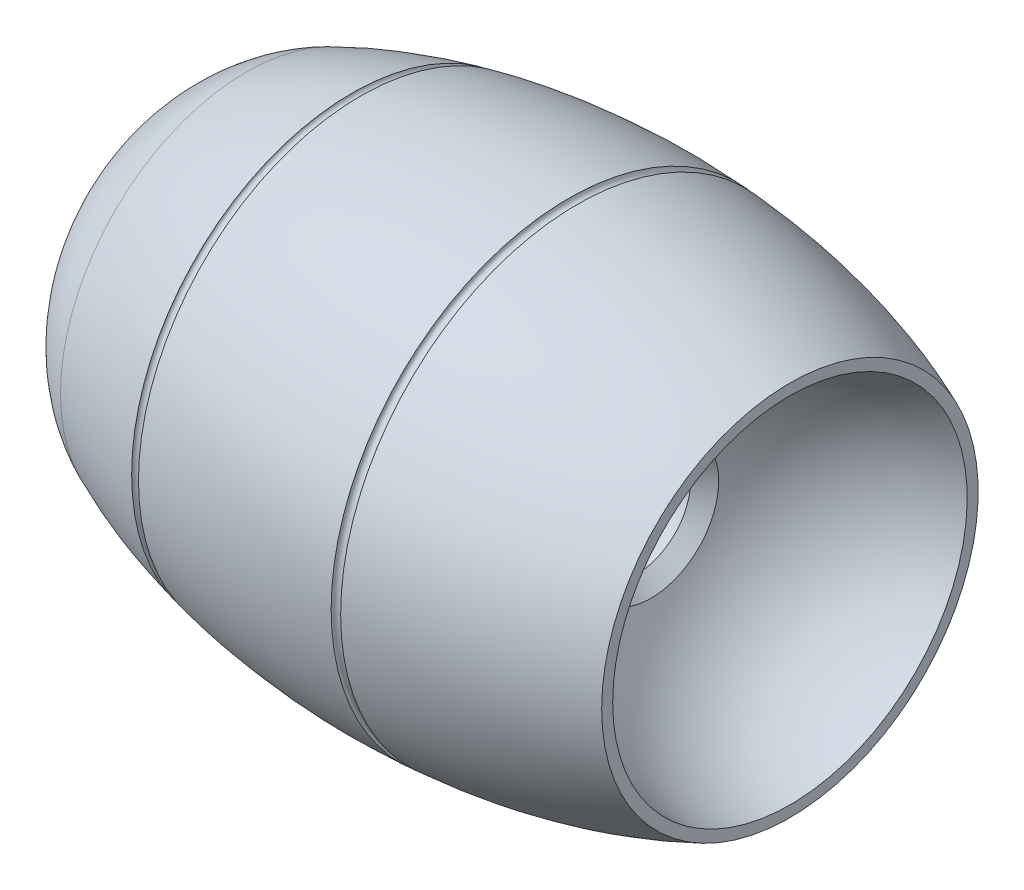
from build123d import *

# Parameters (mm, degrees)
SKETCH24_R = 0.25


with BuildPart() as part:
    # Sketch1 → Revolve2 (revolve)
    with BuildSketch(Plane.XY, mode=Mode.PRIVATE) as revolve2_sk:
        with BuildLine():
            Line((-15.007074186, 0), (15.007074186, 0))
            Line((15.007074186, 0), (15, 10.499997617))
            add(Edge.make_bspline(
                [(15, 10.499997617), (-0.260765985, 16.996362914), (-15.320064817, 10.361380419)],
                knots=[4.050070464, 4.050070464, 4.050070464, 5.391457343, 5.391457343, 5.391457343], degree=2, weights=[1, 0.783390861, 1]))
            add(Edge.make_bspline(
                [(-15.320064817, 10.361380419), (-21.283917109, 7.733764353), (-21.283917109, 0)],
                knots=[3.488253299, 3.488253299, 3.488253299, 4.71238898, 4.71238898, 4.71238898], degree=2, weights=[1, 0.818461668, 1]))
            Line((-21.283917109, 0), (-15.007074186, 0))
        make_face()
    revolve(revolve2_sk.sketch.rotate(Axis((-11.770008151, 0, 0), (1, 0, 0)), 90), axis=Axis((-11.770008151, 0, 0), (1, 0, 0)))

    # Sketch16 → Cut-Revolve1 (revolve, cut)
    with BuildSketch(Plane.XY, mode=Mode.PRIVATE) as cut_revolve1_sk:
        with BuildLine():
            Line((16.5, 0), (16.5, 10))
            ThreePointArc((16.5, 10), (10.583920217, 8.062257748), (6.960607986, 3))
            Line((6.960607986, 3), (-3.039392014, 3))
            Line((-3.039392014, 3), (-3.039392014, 0))
            Line((-3.039392014, 0), (16.5, 0))
        make_face()
    revolve(cut_revolve1_sk.sketch.rotate(Axis((-1.925849318, 0, 0), (1, 0, 0)), 90), axis=Axis((-1.925849318, 0, 0), (1, 0, 0)), mode=Mode.SUBTRACT)

    # Chamfer1: read off the stored shape, not the designer's step
    # Chamfer1 outline → Chamfer1 (revolve, cut)
    with BuildSketch(Plane.YX):
        Polygon((3, 7.24286651), (3, 6.460607986), (3.782258524, 7.24286651), align=None)
    revolve(axis=Axis((0, 0, 0), (1, 0, 0)), mode=Mode.SUBTRACT)

    # Sketch24 → Cut-Revolve2 (revolve, cut)
    with BuildSketch(Plane.XY):
        with Locations((2.896082891, 13.22107924)):
            Circle(SKETCH24_R)
        with Locations((-9.193917109, 12.333216872)):
            Circle(SKETCH24_R)
    revolve(axis=Axis((-21.283917109, 0, 0), (1, 0, 0)), mode=Mode.SUBTRACT)


solid = part.part
